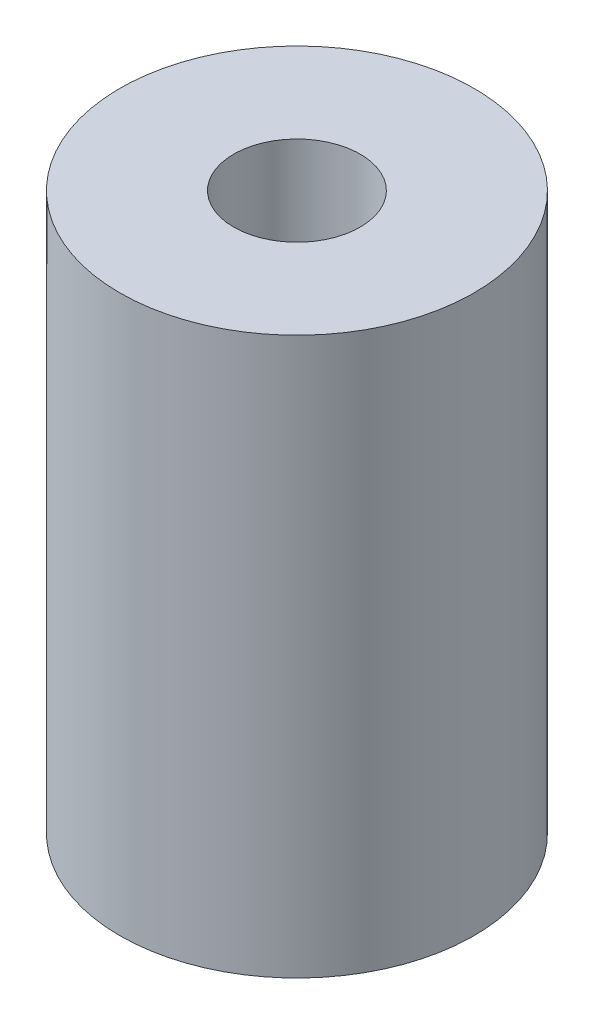
from build123d import *

# Parameters (mm, degrees)
SKETCH_1_R          = 7
EXTRUDE_1_DEPTH     = 22
SKETCH_2_R          = 2.5
CUT_EXTRUDE_2_DEPTH = 22
SKETCH_3_R          = 3
CUT_EXTRUDE_3_DEPTH = 11


with BuildPart() as part:
    # 草图1 → 凸台-拉伸1 (new body)
    with BuildSketch(Plane(origin=(0, 0, 0), x_dir=(1, 0, 0), z_dir=(0, 1, 0))):
        Circle(SKETCH_1_R)
    extrude(amount=EXTRUDE_1_DEPTH)

    # 草图2 → 切除-拉伸2 (cut)
    with BuildSketch(Plane(origin=(0, 22, 0), x_dir=(1, 0, 0), z_dir=(0, 1, 0))):
        Circle(SKETCH_2_R)
    extrude(amount=-CUT_EXTRUDE_2_DEPTH, mode=Mode.SUBTRACT)

    # 草图3 → 切除-拉伸3 (cut)
    with BuildSketch(Plane.XZ):
        Circle(SKETCH_3_R)
    extrude(amount=-CUT_EXTRUDE_3_DEPTH, mode=Mode.SUBTRACT)


solid = part.part
